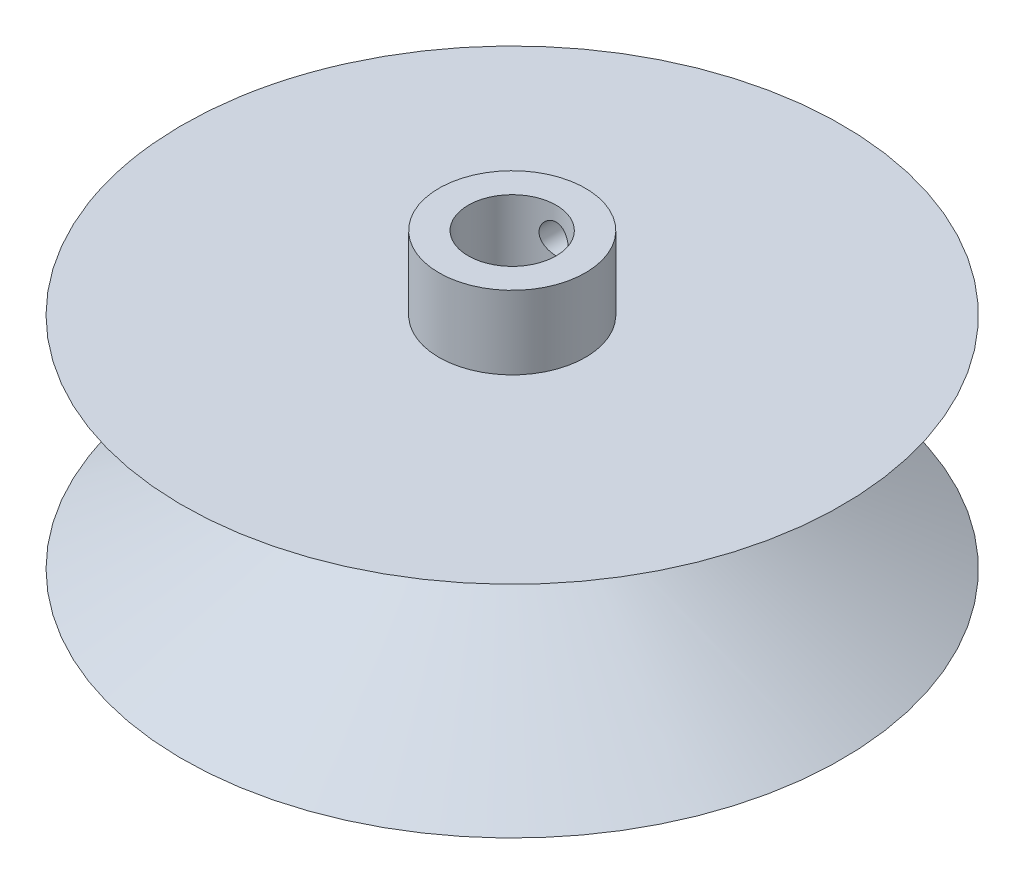
from build123d import *

# Parameters (mm, degrees)
SKETCH3_R               = 5
BOSS_EXTRUDE1_DEPTH     = 5
SKETCH4_R               = 3
CUT_EXTRUDE3_DEPTH      = 20
CUT_EXTRUDE2_REACH      = 39.666
CUT_EXTRUDE2_END_RADIUS = 3
SKETCH6_R               = 1


with BuildPart() as part:
    # Loft1: read off the stored shape, not the designer's step
    # Loft1: loft between two sections, ruled curve by curve
    loft1_from = [
        Edge.make_bspline([(9.916670011, 0, 2.592712073), (15.102094157, 0, -17.240627949), (-4.731245866, 0, -22.426052095), (-9.916670011, 0, -2.592712073), (-15.102094157, 0, 17.240627949), (4.731245866, 0, 22.426052095), (9.916670011, 0, 2.592712073)], [0, 0, 0, 0, 0.5, 0.5, 0.5, 1, 1, 1, 1], 3, [1, 0.333333333, 0.333333333, 1, 0.333333333, 0.333333333, 1]),
    ]
    loft1_to = [
        Edge.make_bspline([(22.487991734, 7.5, 0.735001896), (23.957995526, 7.5, -44.240981571), (-21.017987942, 7.5, -45.710985363), (-22.487991734, 7.5, -0.735001896), (-23.957995526, 7.5, 44.240981571), (21.017987942, 7.5, 45.710985363), (22.487991734, 7.5, 0.735001896)], [0, 0, 0, 0, 0.5, 0.5, 0.5, 1, 1, 1, 1], 3, [1, 0.333333333, 0.333333333, 1, 0.333333333, 0.333333333, 1]),
    ]
    loft1 = Solid(Shell([*[Face.make_surface_from_curves(loft1_from[k], loft1_to[k]) for k in range(1)], Face(Wire(loft1_from)), Face(Wire(loft1_to))]))
    add(loft1)

    # Mirror1: Loft1 across plane
    add(loft1.mirror(Plane.ZX))

    # Sketch3 → Boss-Extrude1 (add)
    with BuildSketch(Plane(origin=(0, 7.5, 0), x_dir=(1, 0, 0), z_dir=(0, 1, 0))):
        with Locations(Location((0, 0, 0), (0, 0, 270))):
            Circle(SKETCH3_R)
    extrude(amount=BOSS_EXTRUDE1_DEPTH)

    # Sketch4 → Cut-Extrude3 (cut)
    with BuildSketch(Plane(origin=(0, 12.5, 0), x_dir=(1, 0, 0), z_dir=(0, 1, 0))):
        with Locations(Location((0, 0, 0), (0, 0, 270))):
            Circle(SKETCH4_R)
    extrude(amount=-CUT_EXTRUDE3_DEPTH, mode=Mode.SUBTRACT)

    # Cut-Extrude2: up to this cylinder (the profile starts outside it)
    cut_extrude2_end = Plane(origin=(0, 10.5, 0), z_dir=(0, 1, 0)) * Cylinder(CUT_EXTRUDE2_END_RADIUS, 86.332, mode=Mode.PRIVATE)
    # Sketch6 → Cut-Extrude2 (cut, up to the surface)
    with BuildSketch(Plane.XY.offset(-5), mode=Mode.PRIVATE) as cut_extrude2_sk1:
        with Locations(Location((0, 10.5, 0), (0, 0, 180))):
            Circle(SKETCH6_R)
    cut_extrude2_tool1 = extrude(cut_extrude2_sk1.sketch, amount=CUT_EXTRUDE2_REACH, mode=Mode.PRIVATE) - cut_extrude2_end
    add(cut_extrude2_tool1.solids().sort_by_distance((0, 10.5, -5))[0], mode=Mode.SUBTRACT)


solid = part.part
